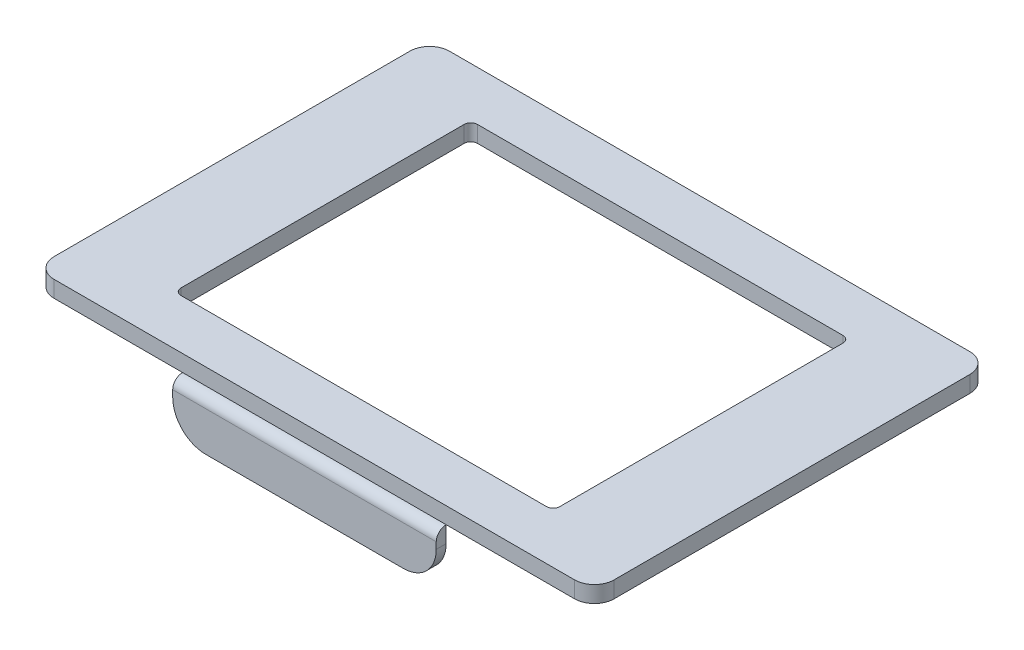
from build123d import *

# Parameters (mm, degrees)
SKETCH1_W           = 170
SKETCH1_H           = 120
BOSS_EXTRUDE1_DEPTH = 5
FILLET1_R           = 6
SKETCH2_W           = 115
SKETCH2_H           = 90
CUT_EXTRUDE1_DEPTH  = 10
FILLET2_R           = 2
SKETCH3_W           = 80
SKETCH3_H           = 15
BOSS_EXTRUDE2_DEPTH = 3
FILLET3_R           = 10
FILLET4_R           = 3
SKETCH4_W           = 80
SKETCH4_H           = 15
BOSS_EXTRUDE3_DEPTH = 3
FILLET5_R           = 3
FILLET6_R           = 10


with BuildPart() as part:
    # Sketch1 → Boss-Extrude1 (new body)
    with BuildSketch(Plane(origin=(0, 0, 0), x_dir=(1, 0, 0), z_dir=(0, 1, 0))):
        Rectangle(SKETCH1_W, SKETCH1_H)
    extrude(amount=BOSS_EXTRUDE1_DEPTH)

    # Fillet1
    fillet1_edges = [part.edges().sort_by_distance(p)[0] for p in [
        (85, 2.5, 60),
        (-85, 2.5, 60),
        (-85, 2.5, -60),
        (85, 2.5, -60),
    ]]
    fillet(fillet1_edges, radius=FILLET1_R)

    # Sketch2 → Cut-Extrude1 (cut)
    with BuildSketch(Plane(origin=(0, 5, 0), x_dir=(1, 0, 0), z_dir=(0, 1, 0))):
        Rectangle(SKETCH2_W, SKETCH2_H)
    extrude(amount=-CUT_EXTRUDE1_DEPTH, mode=Mode.SUBTRACT)

    # Fillet2
    fillet2_edges = [part.edges().sort_by_distance(p)[0] for p in [
        (57.5, 2.5, -45),
        (57.5, 2.5, 45),
        (-57.5, 2.5, 45),
        (-57.5, 2.5, -45),
    ]]
    fillet(fillet2_edges, radius=FILLET2_R)


with BuildPart() as body_2:
    # Sketch3 → Boss-Extrude2 (new body)
    with BuildSketch(Plane.XY.offset(60)):
        with Locations((0, -7.5)):
            Rectangle(SKETCH3_W, SKETCH3_H)
    extrude(amount=BOSS_EXTRUDE2_DEPTH)

    # Fillet3
    fillet3_edges = [body_2.edges().sort_by_distance(p)[0] for p in [
        (40, -15, 61.5),
        (-40, -15, 61.5),
    ]]
    fillet(fillet3_edges, radius=FILLET3_R)

    # Fillet4
    fillet4_edges = [body_2.edges().sort_by_distance(p)[0] for p in [
        (0, 0, 63),
    ]]
    fillet(fillet4_edges, radius=FILLET4_R - 0.0001)  # a hair under: the kernel refuses the full size


with BuildPart() as body_3:
    # Sketch4 → Boss-Extrude3 (new body)
    with BuildSketch(Plane(origin=(0, 0, -60), x_dir=(-1, 0, 0), z_dir=(0, 0, -1))):
        with Locations((0, -7.5)):
            Rectangle(SKETCH4_W, SKETCH4_H)
    extrude(amount=BOSS_EXTRUDE3_DEPTH)

    # Fillet5
    fillet5_edges = [body_3.edges().sort_by_distance(p)[0] for p in [
        (0, 0, -63),
    ]]
    fillet(fillet5_edges, radius=FILLET5_R - 0.0001)  # a hair under: the kernel refuses the full size

    # Fillet6
    fillet6_edges = [body_3.edges().sort_by_distance(p)[0] for p in [
        (-40, -15, -61.5),
        (40, -15, -61.5),
    ]]
    fillet(fillet6_edges, radius=FILLET6_R)


solid = Compound([part.part, body_2.part, body_3.part])
